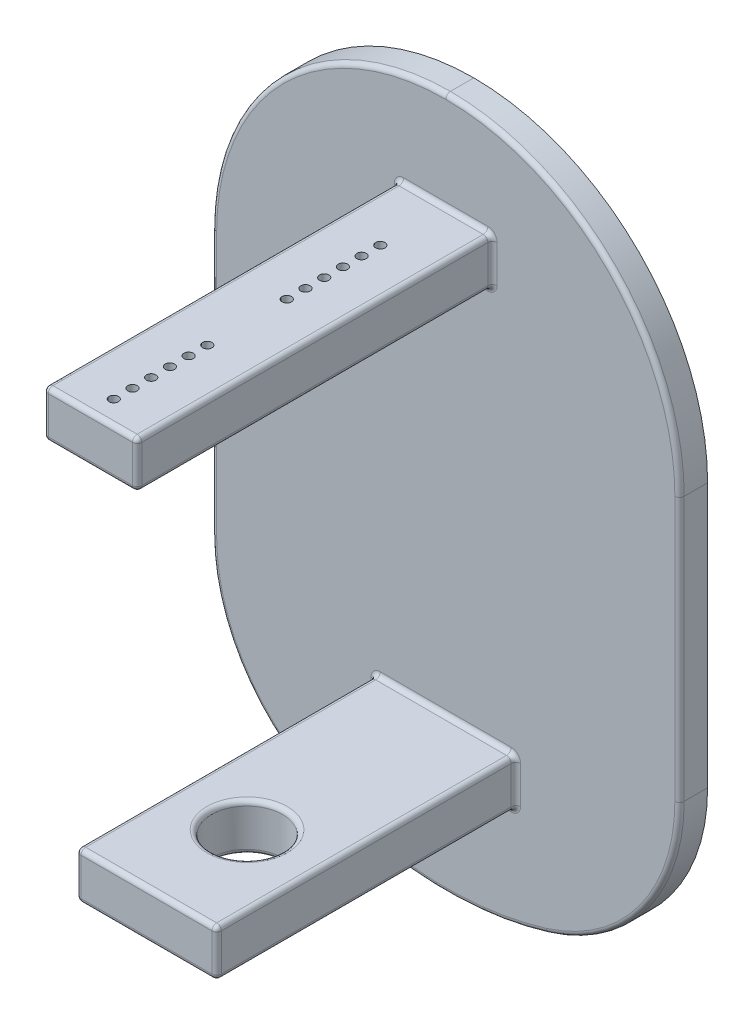
from build123d import *

# Parameters (mm, degrees)
SKETCH1_R           = 37
BOSS_EXTRUDE1_DEPTH = 3
CUT_EXTRUDE3_START  = -10
CUT_EXTRUDE3_DEPTH  = 10
FILLET2_R           = 25
FILLET3_R           = 20
SKETCH2_W           = 10
SKETCH2_H           = 5
BOSS_EXTRUDE2_DEPTH = 38
SKETCH3_R           = 0.5
CUT_EXTRUDE1_DEPTH  = 5
SKETCH4_W           = 15
SKETCH4_H           = 5
BOSS_EXTRUDE3_DEPTH = 32
SKETCH5_R           = 3.8
CUT_EXTRUDE2_DEPTH  = 28
FILLET4_R           = 0.5


with BuildPart() as part:
    # Sketch1 → Boss-Extrude1 (new body)
    with BuildSketch(Plane.XY):
        Circle(SKETCH1_R)
    extrude(amount=BOSS_EXTRUDE1_DEPTH)

    # Sketch6 → Cut-Extrude3 (cut)
    with BuildSketch(Plane.XY.offset(3).offset(CUT_EXTRUDE3_START)):
        with BuildLine():
            Line((-25, 27.276363394), (-25, -27.276363394))
            ThreePointArc((-25, -27.276363394), (-37, 0), (-25, 27.276363394))
        make_face()
        with BuildLine():
            Line((25, -27.276363394), (25, 27.276363394))
            ThreePointArc((25, 27.276363394), (37, 0), (25, -27.276363394))
        make_face()
    extrude(amount=CUT_EXTRUDE3_DEPTH, mode=Mode.SUBTRACT)

    # Fillet2
    fillet2_edges = [part.edges().sort_by_distance(p)[0] for p in [
        (-25, 27.276363394, 1.5),
        (25, 27.276363394, 1.5),
    ]]
    fillet(fillet2_edges, radius=FILLET2_R - 0.0001)  # a hair under: the kernel refuses the full size

    # Fillet3
    fillet3_edges = [part.edges().sort_by_distance(p)[0] for p in [
        (-25, -27.276363394, 1.5),
        (25, -27.276363394, 1.5),
    ]]
    fillet(fillet3_edges, radius=FILLET3_R)

    # Sketch2 → Boss-Extrude2 (add)
    with BuildSketch(Plane.XY.offset(3)):
        with Locations((0, 24)):
            Rectangle(SKETCH2_W, SKETCH2_H)
    extrude(amount=BOSS_EXTRUDE2_DEPTH)

    # Sketch3 → Cut-Extrude1 (cut)
    with BuildSketch(Plane(origin=(0, 26.5, 0), x_dir=(1, 0, 0), z_dir=(0, 1, 0))):
        with Locations(Location((0, -10, 0), (0, 0, 270))):
            Circle(SKETCH3_R)
        with Locations(Location((0, -12, 0), (0, 0, 270))):
            Circle(SKETCH3_R)
        with Locations(Location((0, -14, 0), (0, 0, 270))):
            Circle(SKETCH3_R)
        with Locations(Location((0, -16, 0), (0, 0, 270))):
            Circle(SKETCH3_R)
        with Locations(Location((0, -18, 0), (0, 0, 270))):
            Circle(SKETCH3_R)
        with Locations(Location((0, -20, 0), (0, 0, 270))):
            Circle(SKETCH3_R)
        with Locations(Location((0, -38.5, 0), (0, 0, 270))):
            Circle(SKETCH3_R)
        with Locations(Location((0, -36.5, 0), (0, 0, 270))):
            Circle(SKETCH3_R)
        with Locations(Location((0, -34.5, 0), (0, 0, 270))):
            Circle(SKETCH3_R)
        with Locations(Location((0, -32.5, 0), (0, 0, 270))):
            Circle(SKETCH3_R)
        with Locations(Location((0, -30.5, 0), (0, 0, 270))):
            Circle(SKETCH3_R)
        with Locations(Location((0, -28.5, 0), (0, 0, 270))):
            Circle(SKETCH3_R)
    extrude(amount=-CUT_EXTRUDE1_DEPTH, mode=Mode.SUBTRACT)

    # Sketch4 → Boss-Extrude3 (add)
    with BuildSketch(Plane.XY.offset(3)):
        with Locations((0, -23)):
            Rectangle(SKETCH4_W, SKETCH4_H)
    extrude(amount=BOSS_EXTRUDE3_DEPTH)

    # Sketch5 → Cut-Extrude2 (cut)
    with BuildSketch(Plane(origin=(0, -20.5, 0), x_dir=(1, 0, 0), z_dir=(0, 1, 0))):
        with Locations(Location((0, -24.25, 0), (0, 0, 270))):
            Circle(SKETCH5_R)
    extrude(amount=-CUT_EXTRUDE2_DEPTH, mode=Mode.SUBTRACT)

    # Fillet4
    fillet4_edges = [part.edges().sort_by_distance(p)[0] for p in [
        (7.5, -23, 3),
        (7.5, -25.5, 19),
        (0, -20.5, 3),
        (7.5, -20.5, 19),
        (-7.5, -23, 3),
        (-7.5, -20.5, 19),
        (0, -25.5, 3),
        (-7.5, -25.5, 19),
        (7.5, -23, 35),
        (0, -20.5, 35),
        (-7.5, -23, 35),
        (0, -25.5, 35),
        (0, -25.5, 20.45),
        (0, -20.5, 20.45),
        (25, -2.123988405, 3),
        (17.677772475, 29.677625162, 3),
        (-17.677772475, 29.677625162, 3),
        (0, -37, 3),
        (-25, -2.123988405, 3),
        (-21.087993331, -28.129847325, 3),
        (21.087993331, -28.129847325, 3),
        (5, 24, 3),
        (5, 21.5, 22),
        (0, 26.5, 3),
        (5, 26.5, 22),
        (-5, 24, 3),
        (-5, 26.5, 22),
        (0, 21.5, 3),
        (-5, 21.5, 22),
        (5, 24, 41),
        (0, 26.5, 41),
        (-5, 24, 41),
        (0, 21.5, 41),
    ]]
    fillet(fillet4_edges, radius=FILLET4_R)


solid = part.part
